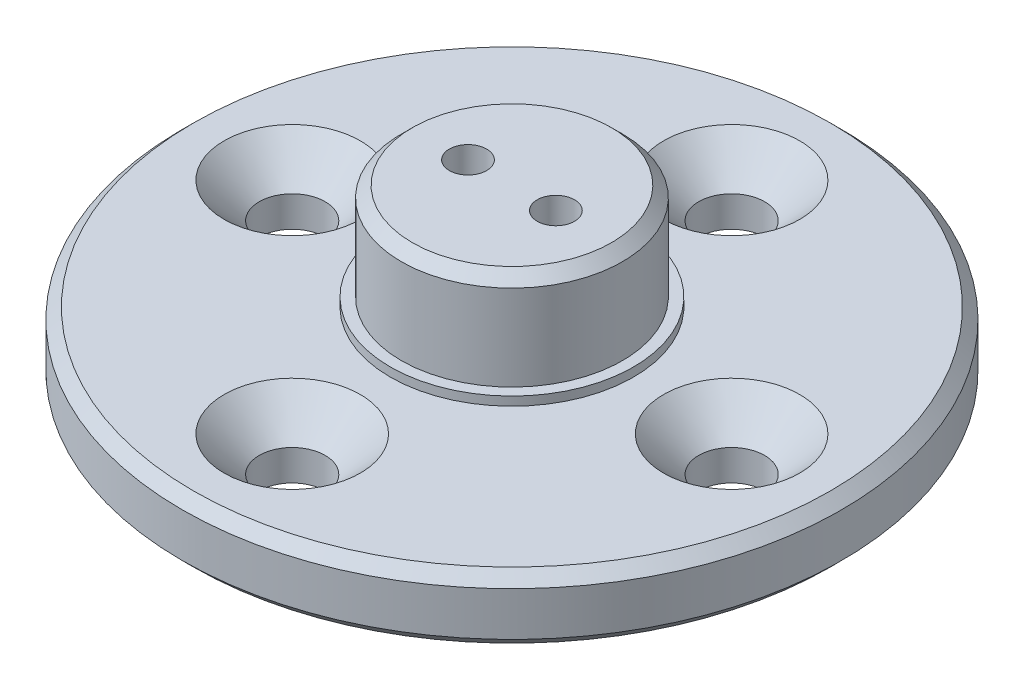
from build123d import *

# Parameters (mm, degrees)
SKETCH_1_R      = 15
SKETCH_1_R_2    = 1.5
EXTRUDE_1_DEPTH = 3
SKETCH_2_R      = 5.035
SKETCH_2_R_2    = 0.85
EXTRUDE_2_DEPTH = 4.8
SKETCH_4_R      = 5.535
EXTRUDE_3_DEPTH = 0.4
CHAMFER_1_SIZE  = 0.5
CHAMFER_3_SIZE  = 0.5
CHAMFER_4_SIZE  = 1.6


with BuildPart() as part:
    # 草图1 → 凸台-拉伸1 (new body)
    with BuildSketch(Plane(origin=(0, 0, 0), x_dir=(1, 0, 0), z_dir=(0, 1, 0))):
        Circle(SKETCH_1_R)
        with Locations((0, 10)):
            Circle(SKETCH_1_R_2, mode=Mode.SUBTRACT)
        with Locations((10, 0)):
            Circle(SKETCH_1_R_2, mode=Mode.SUBTRACT)
        with Locations((0, -10)):
            Circle(SKETCH_1_R_2, mode=Mode.SUBTRACT)
        with Locations((-10, 0)):
            Circle(SKETCH_1_R_2, mode=Mode.SUBTRACT)
    extrude(amount=EXTRUDE_1_DEPTH)

    # 草图2 → 凸台-拉伸2 (add)
    with BuildSketch(Plane(origin=(0, 3, 0), x_dir=(1, 0, 0), z_dir=(0, 1, 0))):
        Circle(SKETCH_2_R)
        with Locations((2, 0)):
            Circle(SKETCH_2_R_2, mode=Mode.SUBTRACT)
        with Locations((-2, 0)):
            Circle(SKETCH_2_R_2, mode=Mode.SUBTRACT)
    extrude(amount=EXTRUDE_2_DEPTH)

    # 草图4 → 凸台-拉伸3 (add)
    with BuildSketch(Plane(origin=(0, 3, 0), x_dir=(1, 0, 0), z_dir=(0, 1, 0))):
        Circle(SKETCH_4_R)
    extrude(amount=EXTRUDE_3_DEPTH)

    # 倒角1
    chamfer_1_edges = [part.edges().sort_by_distance(p)[0] for p in [
        (-5.035, 7.8, 0),
    ]]
    chamfer(chamfer_1_edges, length=CHAMFER_1_SIZE)

    # 倒角3
    chamfer_3_edges = [part.edges().sort_by_distance(p)[0] for p in [
        (-15, 0, 0),
        (-15, 3, 0),
    ]]
    chamfer(chamfer_3_edges, length=CHAMFER_3_SIZE)

    # 倒角4
    chamfer_4_edges = [part.edges().sort_by_distance(p)[0] for p in [
        (8.5, 3, 0),
        (-1.5, 3, 10),
        (-11.5, 3, 0),
        (-1.5, 3, -10),
    ]]
    chamfer(chamfer_4_edges, length=CHAMFER_4_SIZE)


solid = part.part
